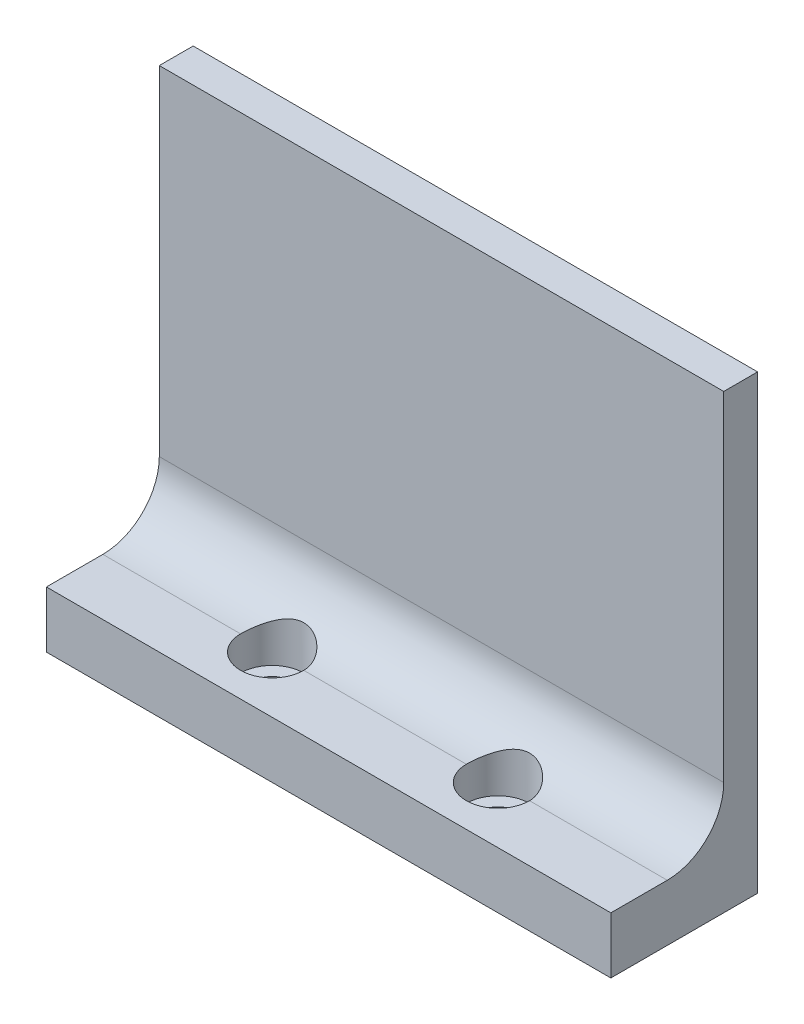
from build123d import *

# Parameters (mm, degrees)
CROQUIS1_W                   = 30
CROQUIS1_H                   = 10
CROQUIS1_R                   = 1.6
SALIENTE_EXTRUIR1_DEPTH      = 5
CROQUIS2_R                   = 2.8
CORTAR_EXTRUIR1_DEPTH        = 3
SALIENTE_EXTRUIR2_DEPTH      = 10
SALIENTE_EXTRUIR2_DEPTH_BACK = 30
CROQUIS3_W                   = 3
CROQUIS3_H                   = 40
CROQUIS4_W                   = 10
CROQUIS4_H                   = 5
SALIENTE_EXTRUIR3_DEPTH      = 10
SALIENTE_EXTRUIR4_DEPTH      = 10
REDONDEO1_R                  = 5


with BuildPart() as part:
    # Croquis1 → Saliente-Extruir1 (new body)
    with BuildSketch(Plane(origin=(0, 0, 0), x_dir=(1, 0, 0), z_dir=(0, 1, 0))):
        with Locations((15, 5)):
            Rectangle(CROQUIS1_W, CROQUIS1_H)
        with Locations(Location((5, 5, 0), (0, 0, 270))):
            Circle(CROQUIS1_R, mode=Mode.SUBTRACT)
        with Locations(Location((25, 5, 0), (0, 0, 270))):
            Circle(CROQUIS1_R, mode=Mode.SUBTRACT)
    extrude(amount=SALIENTE_EXTRUIR1_DEPTH)

    # Croquis2 → Cortar-Extruir1 (cut)
    with BuildSketch(Plane(origin=(0, 5, 0), x_dir=(1, 0, 0), z_dir=(0, 1, 0))):
        with Locations(Location((5, 5, 0), (0, 0, 270))):
            Circle(CROQUIS2_R)
        with Locations(Location((25, 5, 0), (0, 0, 270))):
            Circle(CROQUIS2_R)
    extrude(amount=-CORTAR_EXTRUIR1_DEPTH, mode=Mode.SUBTRACT)

    # Croquis3 → Saliente-Extruir2 (add, two sides: drawn at the far end of the back side and taken through both)
    with BuildSketch(Plane.ZY.offset(-SALIENTE_EXTRUIR2_DEPTH_BACK)):
        with Locations((-11.5, 20)):
            Rectangle(CROQUIS3_W, CROQUIS3_H)
    extrude(amount=SALIENTE_EXTRUIR2_DEPTH + SALIENTE_EXTRUIR2_DEPTH_BACK)

    # Croquis4 → Saliente-Extruir3 (add)
    with BuildSketch(Plane.ZY):
        with Locations((-5, 2.5)):
            Rectangle(CROQUIS4_W, CROQUIS4_H)
    extrude(amount=SALIENTE_EXTRUIR3_DEPTH)

    # Croquis5 → Saliente-Extruir4 (add)
    with BuildSketch(Plane(origin=(30, 0, 0), x_dir=(0, 0, -1), z_dir=(1, 0, 0))):
        Polygon((0, 0), (13, 0), (13, 40), (10, 40), (10, 5), (0, 5), align=None)
    extrude(amount=SALIENTE_EXTRUIR4_DEPTH)

    # Redondeo1
    # the kernel refuses this fillet: 5 mm, written as the material it adds along each edge
    with BuildSketch(Plane(origin=(40, 5, -10), x_dir=(0, 1, 0), z_dir=(-1, 0, 0))) as redondeo1_piece_1_section:
        with BuildLine():
            CenterArc((REDONDEO1_R, -REDONDEO1_R), REDONDEO1_R, 90, 90)
            Line((0, -REDONDEO1_R), (0, 0))
            Line((0, 0), (REDONDEO1_R, 0))
        make_face()
    redondeo1_piece_1 = extrude(amount=50, mode=Mode.PRIVATE)
    redondeo1_piece_1 = redondeo1_piece_1 - Plane(origin=(5, 6.156265405, -5), x_dir=(0, 0, 1), z_dir=(0, 1, 0)) * Cylinder(2.8, 120, mode=Mode.PRIVATE)
    redondeo1_piece_1 = redondeo1_piece_1 - Plane(origin=(25, 6.156265405, -5), x_dir=(0, 0, 1), z_dir=(0, 1, 0)) * Cylinder(2.8, 120, mode=Mode.PRIVATE)
    add(redondeo1_piece_1)


solid = part.part
